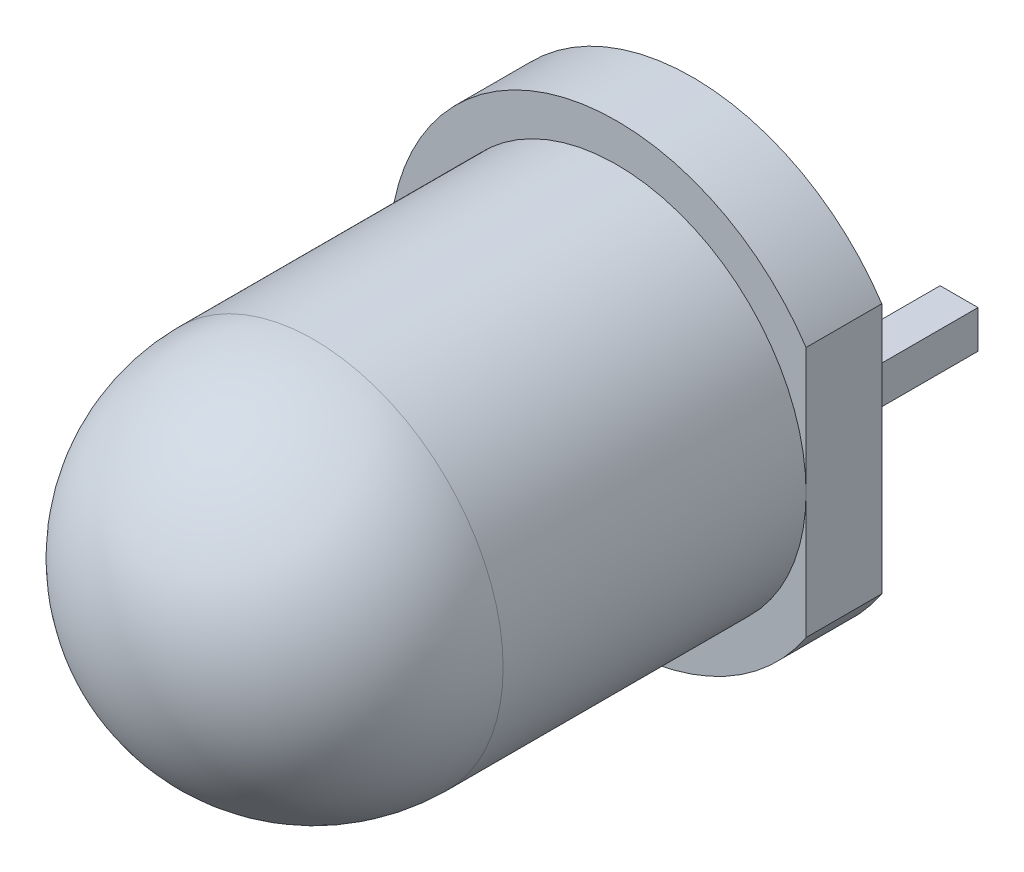
from build123d import *

# Parameters (mm, degrees)
SKETCH1_R           = 3
BOSS_EXTRUDE1_DEPTH = 1
SKETCH2_R           = 2.5
BOSS_EXTRUDE2_DEPTH = 4
DOME1_FACE_RADIUS   = 2.5
DOME1_HEIGHT        = 2.5
CUT_EXTRUDE1_REACH  = 9.762
SKETCH3_W           = 0.5
SKETCH3_H           = 4.031292186
SKETCH8_W           = 0.5
SKETCH8_H           = 2
BASE_FLANGE1_DEPTH  = 0.25
SKETCH9_W           = 0.5
SKETCH9_H           = 2
BASE_FLANGE2_DEPTH  = 0.25


# Sheet-metal steps are written as plain solids
with BuildPart() as part:
    # Sketch1 → Boss-Extrude1 (new body)
    with BuildSketch(Plane.XY):
        Circle(SKETCH1_R)
    extrude(amount=BOSS_EXTRUDE1_DEPTH)

    # Sketch2 → Boss-Extrude2 (add)
    with BuildSketch(Plane.XY.offset(1)):
        Circle(SKETCH2_R)
    extrude(amount=BOSS_EXTRUDE2_DEPTH)

    # Dome1: a dome of height H over a round flat face of radius A is a cap of a sphere of radius (A * A + H * H) / (2 * H)
    dome1_r = (DOME1_FACE_RADIUS * DOME1_FACE_RADIUS + DOME1_HEIGHT * DOME1_HEIGHT) / (2 * DOME1_HEIGHT)
    dome1_base = Plane((0, 0, 5), z_dir=(0, 0, 1))
    with Locations(dome1_base.offset(DOME1_HEIGHT - dome1_r)):
        dome1_ball = Sphere(dome1_r, mode=Mode.PRIVATE)
    add(split(dome1_ball, bisect_by=dome1_base, keep=Keep.TOP, mode=Mode.PRIVATE))

    # Sketch3 → Cut-Extrude1 (cut, up to next)
    with BuildSketch(Plane.XY.offset(1), mode=Mode.PRIVATE) as cut_extrude1_sk1:
        with Locations((2.75, -0.165370345)):
            Rectangle(SKETCH3_W, SKETCH3_H)
    cut_extrude1_tool1 = extrude(cut_extrude1_sk1.sketch, amount=-CUT_EXTRUDE1_REACH, mode=Mode.PRIVATE) & part.part
    add(cut_extrude1_tool1.solids().sort_by_distance((2.75, -0.16537, 1))[0], mode=Mode.SUBTRACT)


with BuildPart() as body_2:
    # Sketch8 → Base-Flange1 (new, symmetric)
    with BuildSketch(Plane(origin=(0, 0, 0), x_dir=(1, 0, 0), z_dir=(0, 1, 0))):
        with Locations((-1.02, 1)):
            Rectangle(SKETCH8_W, SKETCH8_H)
    extrude(amount=BASE_FLANGE1_DEPTH, both=True)


with BuildPart() as body_3:
    # Sketch9 → Base-Flange2 (new, symmetric)
    with BuildSketch(Plane(origin=(0, 0, 0), x_dir=(1, 0, 0), z_dir=(0, 1, 0))):
        with Locations((1.52, 1)):
            Rectangle(SKETCH9_W, SKETCH9_H)
    extrude(amount=BASE_FLANGE2_DEPTH, both=True)


solid = Compound([part.part, body_2.part, body_3.part])
